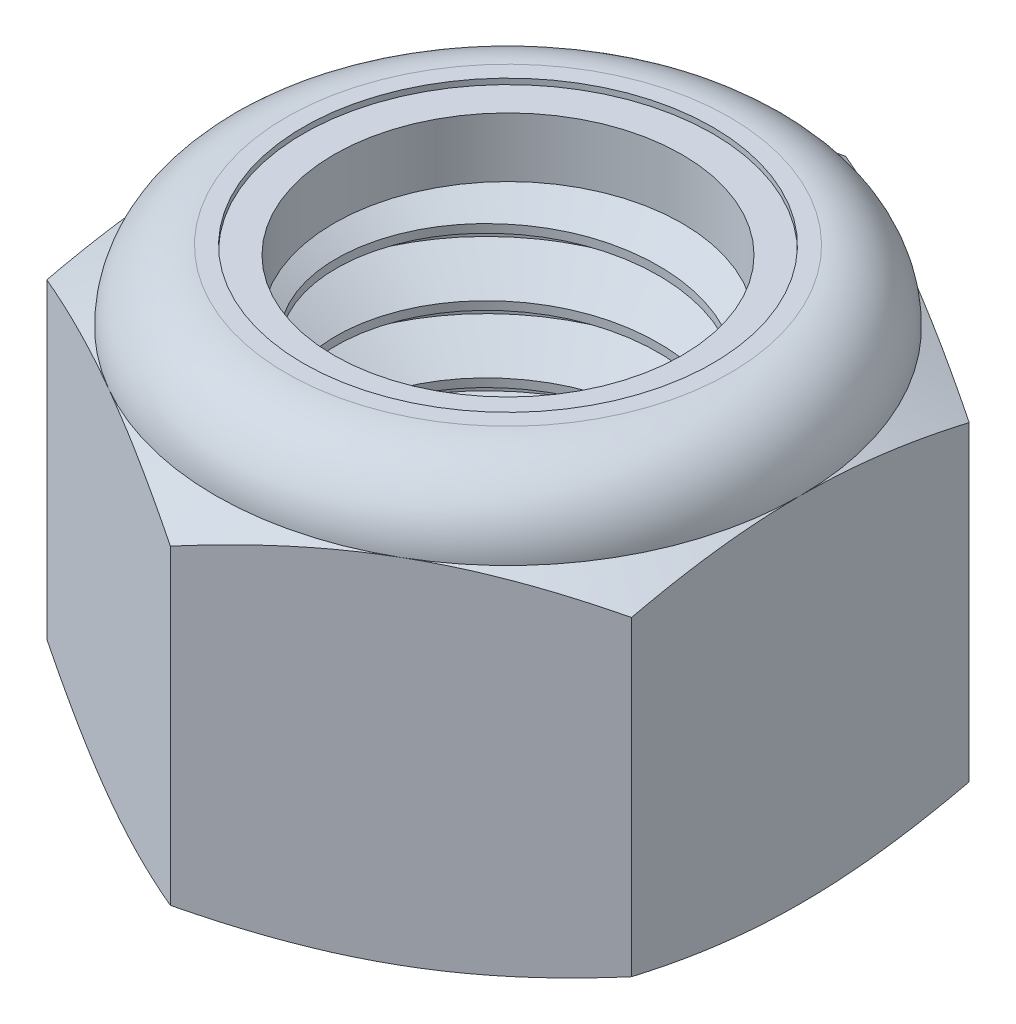
from build123d import *

# Parameters (mm, degrees)
SKETCH1_R        = 5.55625
EXTRUDE1_DEPTH   = 11.509375
SKETCH2_W        = 5.55625
SKETCH2_H        = 9.591145833
CUT_SWEEP1_PITCH = 1.814285714
SKETCH12_W       = 6.111875
SKETCH12_H       = 9.591145833


with BuildPart() as part:
    # Sketch1 → Extrude1 (new body)
    with BuildSketch(Plane(origin=(0, 0, 0), x_dir=(1, 0, 0), z_dir=(0, 1, 0))):
        Polygon((0, 9.165435523), (-7.9375, 4.582717762), (-7.9375, -4.582717762), (0, -9.165435523), (7.9375, -4.582717762), (7.9375, 4.582717762), align=None)
        with Locations(Location((0, 0, 0), (0, 0, 270))):
            Circle(SKETCH1_R, mode=Mode.SUBTRACT)
    extrude(amount=EXTRUDE1_DEPTH)

    # Sketch5 → Cut-Revolve3 (revolve, cut)
    with BuildSketch(Plane(origin=(0, 0, 0), x_dir=(0, 0, -1), z_dir=(1, 0, 0))):
        with BuildLine():
            Line((0, 0), (7.9375, 0))
            Line((7.9375, 0), (9.165435523, 0.572595738))
            Line((9.165435523, 0.572595738), (9.165435523, 9.018550095))
            Line((9.165435523, 9.018550095), (7.9375, 9.591145833))
            ThreePointArc((7.9375, 9.591145833), (7.375663685, 10.947538685), (6.019270833, 11.509375))
            Line((6.019270833, 11.509375), (6.019270833, 12.779375))
            Line((6.019270833, 12.779375), (10.435435523, 12.779375))
            Line((10.435435523, 12.779375), (10.435435523, -1.27))
            Line((10.435435523, -1.27), (0, -1.27))
            Line((0, -1.27), (0, 0))
        make_face()
    revolve(axis=Axis((0, 0, 0), (0, 1, 0)), mode=Mode.SUBTRACT)

    # Sketch6 → Cut-Revolve4 (revolve, cut)
    with BuildSketch(Plane(origin=(0, 0, 0), x_dir=(0, 0, -1), z_dir=(1, 0, 0)), mode=Mode.PRIVATE) as cut_revolve4_sk:
        with BuildLine():
            Line((0, 9.591145833), (7.7851, 9.591145833))
            ThreePointArc((7.7851, 9.591145833), (7.267900612, 10.839775612), (6.019270833, 11.356975))
            Line((6.019270833, 11.356975), (3.009635417, 11.356975))
            Line((3.009635417, 11.356975), (3.009635417, 12.779375))
            Line((3.009635417, 12.779375), (0, 12.779375))
            Line((0, 12.779375), (0, 9.591145833))
        make_face()
    revolve(cut_revolve4_sk.sketch.rotate(Axis((0, 12.779375, 0), (0, -1, 0)), 180), axis=Axis((0, 12.779375, 0), (0, -1, 0)), mode=Mode.SUBTRACT)

    # Sketch4 → Cut-Revolve2 (revolve, cut)
    with BuildSketch(Plane(origin=(0, 0, 0), x_dir=(0, 0, -1), z_dir=(1, 0, 0))):
        Polygon((0, 9.591145833), (6.111875, 9.591145833), (0, 6.741131715), align=None)
        Polygon((0, 2.850014118), (6.111875, 0), (0, 0), align=None)
    revolve(axis=Axis((0, 0, 0), (0, 1, 0)), mode=Mode.SUBTRACT)

    # Sketch12 → Revolve4 (revolve)
    with BuildSketch(Plane(origin=(0, 0, 0), x_dir=(0, 0, -1), z_dir=(1, 0, 0)), mode=Mode.PRIVATE) as revolve4_sk:
        with Locations((3.0559375, 4.795572917)):
            Rectangle(SKETCH12_W, SKETCH12_H)
    revolve(revolve4_sk.sketch.rotate(Axis((0, 0, 0), (0, 1, 0)), 353.171342594), axis=Axis((0, 0, 0), (0, 1, 0)))


with BuildPart() as body_2:
    # Sketch7 → Revolve2 (revolve)
    with BuildSketch(Plane(origin=(0, 0, 0), x_dir=(0, 0, -1), z_dir=(1, 0, 0))):
        with BuildLine():
            Line((4.7228125, 9.667345833), (7.707180867, 9.667345833))
            ThreePointArc((7.707180867, 9.667345833), (7.18676751, 10.812537757), (6.019270833, 11.280775))
            Line((6.019270833, 11.280775), (4.7228125, 11.280775))
            Line((4.7228125, 11.280775), (4.7228125, 9.667345833))
        make_face()
    revolve(axis=Axis((0, 9.667345833, 0), (0, 1, 0)))


with BuildPart() as body_3:
    # Sketch2 → Revolve1 (revolve)
    with BuildSketch(Plane(origin=(0, 0, 0), x_dir=(0, 0, -1), z_dir=(1, 0, 0))):
        with Locations((2.778125, 4.795572917)):
            Rectangle(SKETCH2_W, SKETCH2_H)
    revolve(axis=Axis((0, -5.55625, 0), (0, 1, 0)))

    # Cut-Sweep1: the profile of Sketch9 screwed along a right-hand helix of 7.34375 turns, 10 arcs to a turn; built about Z, then put on its axis
    cut_sweep1_z = Axis((0, 0, 0), (0, 0, 1))
    cut_sweep1_corners = [(5.75265219, 0, 0.113392857), (5.654451095, 0, -1.644196429), (4.377836861, 0, -0.907142857), (4.377836861, 0, -0.680357143)]
    with BuildLine(mode=Mode.PRIVATE) as cut_sweep1_profile:
        Line(cut_sweep1_corners[0], cut_sweep1_corners[1])
        Line(cut_sweep1_corners[1], cut_sweep1_corners[2])
        Line(cut_sweep1_corners[2], cut_sweep1_corners[3])
        Line(cut_sweep1_corners[3], cut_sweep1_corners[0])
    cut_sweep1_cap = Face(cut_sweep1_profile.wire())
    cut_sweep1_turn_angles = [0, 18, 36, 54, 72, 90, 108, 126, 144, 162, 180, 198, 216, 234, 252, 270, 288, 306, 324, 342, 360]
    cut_sweep1_turn_weights = [1, 0.9510565162951535, 1, 0.9510565162951535, 1, 0.9510565162951535, 1, 0.9510565162951535, 1, 0.9510565162951535, 1, 0.9510565162951535, 1, 0.9510565162951535, 1, 0.9510565162951535, 1, 0.9510565162951535, 1, 0.9510565162951535, 1]
    cut_sweep1_turn_rails = [Edge.make_bspline([Vector(p[0], p[1], 0).rotate(cut_sweep1_z, cut_sweep1_turn_angles[k]) / cut_sweep1_turn_weights[k] + Vector(0, 0, p[2] + CUT_SWEEP1_PITCH * cut_sweep1_turn_angles[k] / 360) for k in range(21)], [0, 0, 0, 1, 1, 2, 2, 3, 3, 4, 4, 5, 5, 6, 6, 7, 7, 8, 8, 9, 9, 10, 10, 10], 2, cut_sweep1_turn_weights) for p in cut_sweep1_corners]
    cut_sweep1_turn_sides = [Face.make_surface_from_curves(cut_sweep1_turn_rails[p[0]], cut_sweep1_turn_rails[p[1]]) for p in [(0, 1), (1, 2), (2, 3), (3, 0)]]
    cut_sweep1_last_angles = [2520, 2538, 2556, 2574, 2592, 2610, 2628, 2635.875, 2643.75]
    cut_sweep1_last_weights = [1, 0.9510565162951535, 1, 0.9510565162951535, 1, 0.9510565162951535, 1, 0.9905693404435735, 1]
    cut_sweep1_last_rails = [Edge.make_bspline([Vector(p[0], p[1], 0).rotate(cut_sweep1_z, cut_sweep1_last_angles[k]) / cut_sweep1_last_weights[k] + Vector(0, 0, p[2] + CUT_SWEEP1_PITCH * cut_sweep1_last_angles[k] / 360) for k in range(9)], [0, 0, 0, 1, 1, 2, 2, 3, 3, 4, 4, 4], 2, cut_sweep1_last_weights) for p in cut_sweep1_corners]
    cut_sweep1_last_sides = [Face.make_surface_from_curves(cut_sweep1_last_rails[p[0]], cut_sweep1_last_rails[p[1]]) for p in [(0, 1), (1, 2), (2, 3), (3, 0)]]
    cut_sweep1 = Plane(origin=(0, 9.591145833, 0), x_dir=(0, 0, -1), z_dir=(0, -1, 0)) * Solid(Shell([*[p.moved(Location((0, 0, CUT_SWEEP1_PITCH * i))) for i in range(7) for p in cut_sweep1_turn_sides], *cut_sweep1_last_sides, cut_sweep1_cap, cut_sweep1_cap.rotate(cut_sweep1_z, 2643.75).moved(Location((0, 0, CUT_SWEEP1_PITCH * 2643.75 / 360)))]))
    add(cut_sweep1, mode=Mode.SUBTRACT)

    # Sketch11 → Revolve3 (revolve)
    with BuildSketch(Plane(origin=(0, 0, 0), x_dir=(0, 0, -1), z_dir=(1, 0, 0))):
        Polygon((0, 0), (6.111875, 0), (0, 2.850014118), align=None)
    revolve(axis=Axis((0, 11.509375, 0), (0, -1, 0)))


with BuildPart() as part_1:
    add(part.part)

    # Combine1: cut body 3
    add(body_3.part, mode=Mode.SUBTRACT)


solid = Compound([body_2.part, part_1.part])
